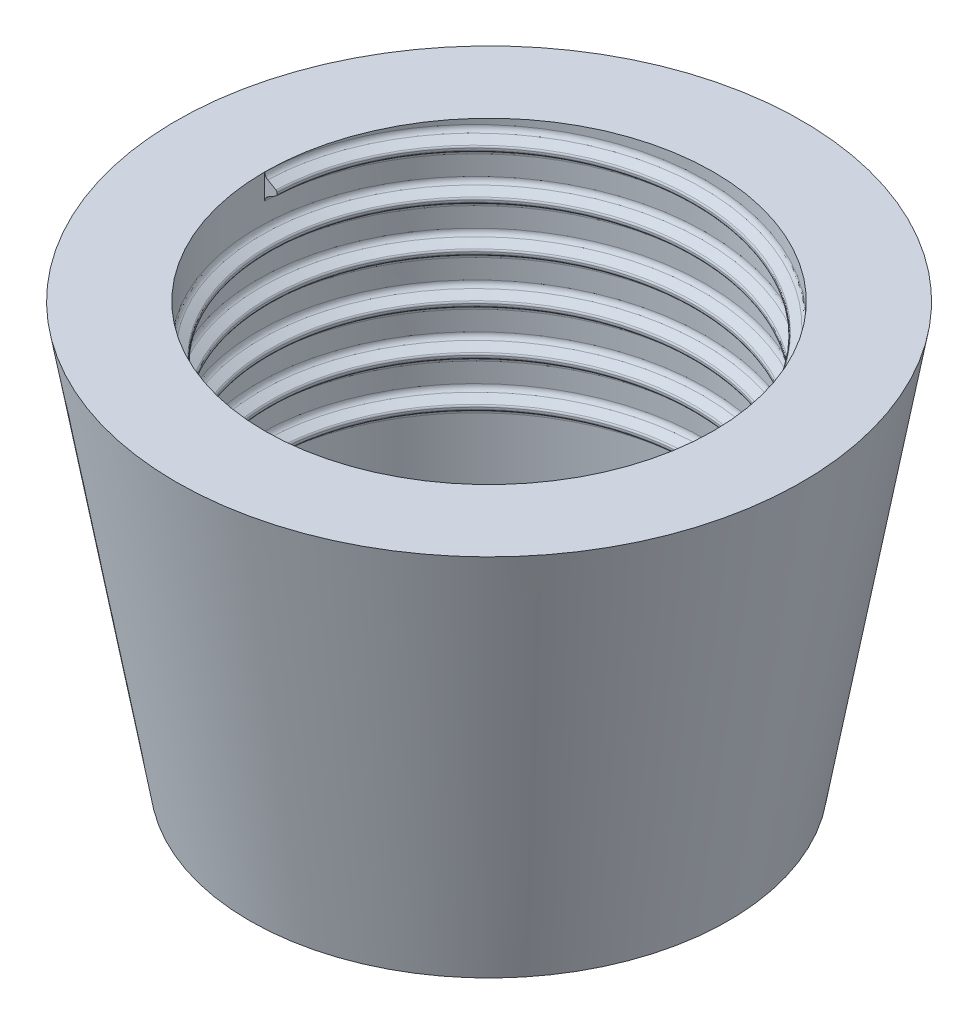
from build123d import *
from build123d.topology import SkipClean

# Parameters (mm, degrees)
SKETCH1_R           = 16
BOSS_EXTRUDE1_DEPTH = 20
BOSS_EXTRUDE1_DRAFT = -10
SKETCH10_R          = 14
CUT_EXTRUDE2_DEPTH  = 20
THREAD1_PITCH       = 2.8
SKETCH20_R          = 16
BOSS_EXTRUDE3_DEPTH = 6
BOSS_EXTRUDE3_TAPER = 10
SKETCH19_R          = 6.75
CUT_EXTRUDE3_DEPTH  = 3
SKETCH127_R         = 5
CUT_EXTRUDE4_DEPTH  = 3


with BuildPart() as part:
    # Sketch1 → Boss-Extrude1 (with draft: the straight prism first)
    with BuildSketch(Plane(origin=(0, 0, 0), x_dir=(1, 0, 0), z_dir=(0, 1, 0))):
        Circle(SKETCH1_R)
    extrude(amount=BOSS_EXTRUDE1_DEPTH)
    # Boss-Extrude1: the draft: its side faces are tilted about the plane it starts from
    boss_extrude1_sides = [part.faces().sort_by_distance(p)[0] for p in [
        (-16, 10, 0),
    ]]
    draft(boss_extrude1_sides, Plane(origin=(0, 0, 0), x_dir=(1, 0, 0), z_dir=(0, 1, 0)), BOSS_EXTRUDE1_DRAFT)

    # Sketch10 → Cut-Extrude2 (cut)
    with BuildSketch(Plane(origin=(0, 20, 0), x_dir=(1, 0, 0), z_dir=(0, 1, 0))):
        with Locations(Location((0, 0, 0), (0, 0, 270))):
            Circle(SKETCH10_R)
    extrude(amount=-CUT_EXTRUDE2_DEPTH, mode=Mode.SUBTRACT)

    # Thread1: the profile of Thread Profile2 profile screwed along a right-hand helix of 5.714286 turns, 10 arcs to a turn; built about Z, then put on its axis
    with SkipClean():  # the faces are left unmerged after this step: merging them gives an invalid solid
        thread1_z = Axis((0, 0, 0), (0, 0, 1))
        thread1_corners = [(14.0006, 0, 0), (14.0006, 0, 1.582940905), (14, 0, 1.582940905), (13.8095, 0, 1.252985226), (13.3015, 0, 0.95969129), (13.238, 0, 0.849706063), (13.238, 0, 0.733234842), (13.3015, 0, 0.623249616), (13.8095, 0, 0.329955679), (14, 0, 0)]
        with BuildLine(mode=Mode.PRIVATE) as thread1_profile:
            Line(thread1_corners[0], thread1_corners[1])
            Line(thread1_corners[3], thread1_corners[4])
            Line(thread1_corners[5], thread1_corners[6])
            Line(thread1_corners[7], thread1_corners[8])
            Line(thread1_corners[9], thread1_corners[0])
            Line(thread1_corners[2], thread1_corners[1])
            ThreePointArc((14, 0, 1.582940905), (13.948955679, 0, 1.392440905), (13.8095, 0, 1.252985226))
            ThreePointArc((13.3015, 0, 0.95969129), (13.255014774, 0, 0.913206063), (13.238, 0, 0.849706063))
            ThreePointArc((13.238, 0, 0.733234842), (13.255014774, 0, 0.669734842), (13.3015, 0, 0.623249616))
            ThreePointArc((13.8095, 0, 0.329955679), (13.948955679, 0, 0.1905), (14, 0, 0))
        thread1_cap = Face(thread1_profile.wire())
        thread1_arcs = [((14, 0, 1.582940905), (14, 0, 1.362970453), (13.8095, 0, 1.252985226), (1, 0.8660254037844384, 1)), ((13.3015, 0, 0.95969129), (13.238, 0, 0.923029547), (13.238, 0, 0.849706063), (1, 0.8660254037844415, 1)), ((13.238, 0, 0.733234842), (13.238, 0, 0.659911358), (13.3015, 0, 0.623249616), (1, 0.8660254037844367, 1)), ((13.8095, 0, 0.329955679), (14, 0, 0.219970453), (14, 0, 0), (1, 0.8660254037844375, 1))]  # start, shoulder, end, weights
        thread1_turn_angles = [0, 18, 36, 54, 72, 90, 108, 126, 144, 162, 180, 198, 216, 234, 252, 270, 288, 306, 324, 342, 360]
        thread1_turn_weights = [1, 0.9510565162951535, 1, 0.9510565162951535, 1, 0.9510565162951535, 1, 0.9510565162951535, 1, 0.9510565162951535, 1, 0.9510565162951535, 1, 0.9510565162951535, 1, 0.9510565162951535, 1, 0.9510565162951535, 1, 0.9510565162951535, 1]
        thread1_turn_rails = [Edge.make_bspline([Vector(p[0], p[1], 0).rotate(thread1_z, thread1_turn_angles[k]) / thread1_turn_weights[k] + Vector(0, 0, p[2] + THREAD1_PITCH * thread1_turn_angles[k] / 360) for k in range(21)], [0, 0, 0, 1, 1, 2, 2, 3, 3, 4, 4, 5, 5, 6, 6, 7, 7, 8, 8, 9, 9, 10, 10, 10], 2, thread1_turn_weights) for p in thread1_corners]
        thread1_turn_sides = [*[Face.make_surface_from_curves(thread1_turn_rails[p[0]], thread1_turn_rails[p[1]]) for p in [(0, 1), (3, 4), (5, 6), (7, 8), (9, 0), (2, 1)]], *[Face.make_bezier_surface([[Vector(p[j][0], p[j][1], 0).rotate(thread1_z, thread1_turn_angles[2 * i + k]) / thread1_turn_weights[2 * i + k] + Vector(0, 0, p[j][2] + THREAD1_PITCH * thread1_turn_angles[2 * i + k] / 360) for k in range(3)] for j in range(3)], [[p[3][j] * thread1_turn_weights[2 * i + k] for k in range(3)] for j in range(3)]) for p in thread1_arcs for i in range(10)]]
        thread1_last_angles = [1800, 1818, 1836, 1854, 1872, 1890, 1908, 1926, 1944, 1962, 1980, 1998, 2016, 2034, 2052, 2054.571428571, 2057.142857143]
        thread1_last_weights = [1, 0.9510565162951535, 1, 0.9510565162951535, 1, 0.9510565162951535, 1, 0.9510565162951535, 1, 0.9510565162951535, 1, 0.9510565162951535, 1, 0.9510565162951535, 1, 0.9989930665413146, 1]
        thread1_last_rails = [Edge.make_bspline([Vector(p[0], p[1], 0).rotate(thread1_z, thread1_last_angles[k]) / thread1_last_weights[k] + Vector(0, 0, p[2] + THREAD1_PITCH * thread1_last_angles[k] / 360) for k in range(17)], [0, 0, 0, 1, 1, 2, 2, 3, 3, 4, 4, 5, 5, 6, 6, 7, 7, 8, 8, 8], 2, thread1_last_weights) for p in thread1_corners]
        thread1_last_sides = [*[Face.make_surface_from_curves(thread1_last_rails[p[0]], thread1_last_rails[p[1]]) for p in [(0, 1), (3, 4), (5, 6), (7, 8), (9, 0), (2, 1)]], *[Face.make_bezier_surface([[Vector(p[j][0], p[j][1], 0).rotate(thread1_z, thread1_last_angles[2 * i + k]) / thread1_last_weights[2 * i + k] + Vector(0, 0, p[j][2] + THREAD1_PITCH * thread1_last_angles[2 * i + k] / 360) for k in range(3)] for j in range(3)], [[p[3][j] * thread1_last_weights[2 * i + k] for k in range(3)] for j in range(3)]) for p in thread1_arcs for i in range(8)]]
        thread1 = Plane(origin=(0, 20, 0), x_dir=(-1, 0, 0), z_dir=(0, -1, 0)) * Solid(Shell([*[p.moved(Location((0, 0, THREAD1_PITCH * i))) for i in range(5) for p in thread1_turn_sides], *thread1_last_sides, thread1_cap, thread1_cap.rotate(thread1_z, 2057.142857143).moved(Location((0, 0, THREAD1_PITCH * 2057.142857143 / 360)))]))
        add(thread1)

    # Sketch20 → Boss-Extrude3 (add)
    with SkipClean():  # the faces are left unmerged after this step: merging them gives an invalid solid
        with BuildSketch(Plane.XZ):
            Circle(SKETCH20_R)
        extrude(amount=BOSS_EXTRUDE3_DEPTH, taper=BOSS_EXTRUDE3_TAPER)

    # Sketch19 → Cut-Extrude3 (cut)
    with SkipClean():  # the faces are left unmerged after this step: merging them gives an invalid solid
        with BuildSketch(Plane(origin=(0, 0, 0), x_dir=(-1, 0, 0), z_dir=(0, -1, 0))):
            with Locations(Location((0, 0, 0), (0, 0, 90))):
                Circle(SKETCH19_R)
        extrude(amount=CUT_EXTRUDE3_DEPTH, mode=Mode.SUBTRACT)

    # Sketch127 → Cut-Extrude4 (cut)
    with SkipClean():  # the faces are left unmerged after this step: merging them gives an invalid solid
        with BuildSketch(Plane(origin=(0, -3, 0), x_dir=(1, 0, 0), z_dir=(0, 1, 0))):
            with Locations(Location((0, 0, 0), (0, 0, 270))):
                Circle(SKETCH127_R)
        extrude(amount=-CUT_EXTRUDE4_DEPTH, mode=Mode.SUBTRACT)


solid = part.part
